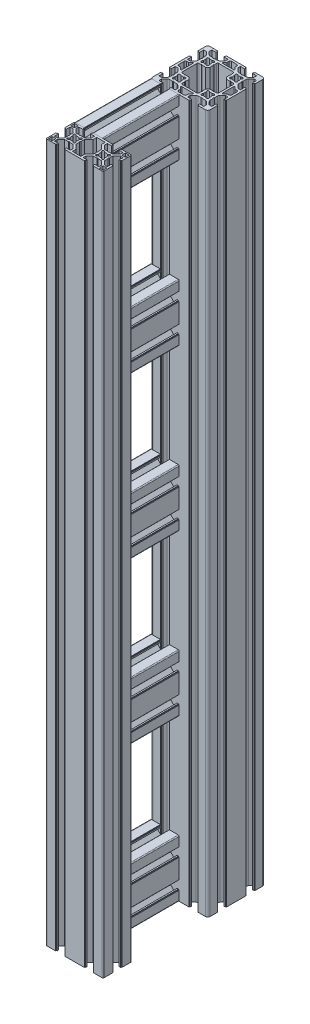
from build123d import *

# Parameters (mm, degrees)
T_SLOT_CNCCAT_6060_1_DEPTH       = 734
T_SLOT_START                     = -367
T_SLOT_CNCCAT_3060_1_OUTLINE_W   = 3.960773678
T_SLOT_CNCCAT_3060_1_OUTLINE_H   = 3.960773678
T_SLOT_CNCCAT_3060_1_DEPTH       = 734
T_SLOT_START_2                   = -85
T_SLOT_CNCCAT_3060_1_2_OUTLINE_W = 3.960773678
T_SLOT_CNCCAT_3060_1_2_OUTLINE_H = 3.960773678
T_SLOT_CNCCAT_3060_1_2_DEPTH     = 140
LPATTERN1_COUNT                  = 5
LPATTERN1_PITCH                  = 168.5


# Read off the part's stored shape, not the designer's step: T-slot CNCCAT-3060(1)
with BuildPart() as part:
    # Sketch23 → T-slot CNCCAT-6060(1) (new body)
    with BuildSketch(Plane(origin=(0, -367, -55), x_dir=(1, 0, 0), z_dir=(0, 1, 0))):
        with BuildLine():
            Line((-27.8, 10.9), (-29.308948277, 10.9))
            Line((-29.308948277, 10.9), (-29.308948277, 10.352456872))
            Line((-29.308948277, 10.352456872), (-30, 10.352456872))
            Line((-30, 10.352456872), (-30, -10.352456872))
            Line((-30, -10.352456872), (-29.308948277, -10.352456872))
            Line((-29.308948277, -10.352456872), (-29.308948277, -10.9))
            Line((-29.308948277, -10.9), (-27.8, -10.9))
            Line((-27.8, -10.9), (-27.8, -6.454151397))
            Line((-27.8, -6.454151397), (-25.075389995, -6.454151397))
            Line((-25.075389995, -6.454151397), (-22.070492345, -9.459049047))
            ThreePointArc((-22.070492345, -9.459049047), (-21.508667773, -10.299878939), (-21.311381219, -11.291705423))
            Line((-21.311381219, -11.291705423), (-21.311381219, -14.439031423))
            ThreePointArc((-21.311381219, -14.439031423), (-20.750412642, -15), (-21.311381219, -15.560968577))
            Line((-21.311381219, -15.560968577), (-21.311381219, -18.708294577))
            ThreePointArc((-21.311381219, -18.708294577), (-21.508667773, -19.700121061), (-22.070492345, -20.540950953))
            Line((-22.070492345, -20.540950953), (-25.075389995, -23.545848603))
            Line((-25.075389995, -23.545848603), (-27.8, -23.545848603))
            Line((-27.8, -23.545848603), (-27.8, -19.1))
            Line((-27.8, -19.1), (-29.308948277, -19.1))
            Line((-29.308948277, -19.1), (-29.308948277, -19.647543128))
            Line((-29.308948277, -19.647543128), (-30, -19.647543128))
            Line((-30, -19.647543128), (-30, -27.5))
            ThreePointArc((-30, -27.5), (-29.267766953, -29.267766953), (-27.5, -30))
            Line((-27.5, -30), (-19.647543128, -30))
            Line((-19.647543128, -30), (-19.647543128, -29.308948277))
            Line((-19.647543128, -29.308948277), (-19.1, -29.308948277))
            Line((-19.1, -29.308948277), (-19.1, -27.8))
            Line((-19.1, -27.8), (-23.545848603, -27.8))
            Line((-23.545848603, -27.8), (-23.545848603, -25.075389995))
            Line((-23.545848603, -25.075389995), (-20.540950953, -22.070492345))
            ThreePointArc((-20.540950953, -22.070492345), (-19.700121061, -21.508667773), (-18.708294577, -21.311381219))
            Line((-18.708294577, -21.311381219), (-15.560968577, -21.311381219))
            ThreePointArc((-15.560968577, -21.311381219), (-15, -20.750412642), (-14.439031423, -21.311381219))
            Line((-14.439031423, -21.311381219), (-11.291705423, -21.311381219))
            ThreePointArc((-11.291705423, -21.311381219), (-10.299878939, -21.508667773), (-9.459049047, -22.070492345))
            Line((-9.459049047, -22.070492345), (-6.454151397, -25.075389995))
            Line((-6.454151397, -25.075389995), (-6.454151397, -27.8))
            Line((-6.454151397, -27.8), (-10.9, -27.8))
            Line((-10.9, -27.8), (-10.9, -29.308948277))
            Line((-10.9, -29.308948277), (-10.352456872, -29.308948277))
            Line((-10.352456872, -29.308948277), (-10.352456872, -30))
            Line((-10.352456872, -30), (10.352456872, -30))
            Line((10.352456872, -30), (10.352456872, -29.308948277))
            Line((10.352456872, -29.308948277), (10.9, -29.308948277))
            Line((10.9, -29.308948277), (10.9, -27.8))
            Line((10.9, -27.8), (6.454151397, -27.8))
            Line((6.454151397, -27.8), (6.454151397, -25.075389995))
            Line((6.454151397, -25.075389995), (9.459049047, -22.070492345))
            ThreePointArc((9.459049047, -22.070492345), (10.299878939, -21.508667773), (11.291705423, -21.311381219))
            Line((11.291705423, -21.311381219), (14.439031423, -21.311381219))
            ThreePointArc((14.439031423, -21.311381219), (15, -20.750412642), (15.560968577, -21.311381219))
            Line((15.560968577, -21.311381219), (18.708294577, -21.311381219))
            ThreePointArc((18.708294577, -21.311381219), (19.700121061, -21.508667773), (20.540950953, -22.070492345))
            Line((20.540950953, -22.070492345), (23.545848603, -25.075389995))
            Line((23.545848603, -25.075389995), (23.545848603, -27.8))
            Line((23.545848603, -27.8), (19.1, -27.8))
            Line((19.1, -27.8), (19.1, -29.308948277))
            Line((19.1, -29.308948277), (19.647543128, -29.308948277))
            Line((19.647543128, -29.308948277), (19.647543128, -30))
            Line((19.647543128, -30), (27.5, -30))
            ThreePointArc((27.5, -30), (29.267766953, -29.267766953), (30, -27.5))
            Line((30, -27.5), (30, -19.647543128))
            Line((30, -19.647543128), (29.308948277, -19.647543128))
            Line((29.308948277, -19.647543128), (29.308948277, -19.1))
            Line((29.308948277, -19.1), (27.8, -19.1))
            Line((27.8, -19.1), (27.8, -23.545848603))
            Line((27.8, -23.545848603), (25.075389995, -23.545848603))
            Line((25.075389995, -23.545848603), (22.070492345, -20.540950953))
            ThreePointArc((22.070492345, -20.540950953), (21.508667773, -19.700121061), (21.311381219, -18.708294577))
            Line((21.311381219, -18.708294577), (21.311381219, -15.560968577))
            ThreePointArc((21.311381219, -15.560968577), (20.750412642, -15), (21.311381219, -14.439031423))
            Line((21.311381219, -14.439031423), (21.311381219, -11.291705423))
            ThreePointArc((21.311381219, -11.291705423), (21.508667773, -10.299878939), (22.070492345, -9.459049047))
            Line((22.070492345, -9.459049047), (25.075389995, -6.454151397))
            Line((25.075389995, -6.454151397), (27.8, -6.454151397))
            Line((27.8, -6.454151397), (27.8, -10.9))
            Line((27.8, -10.9), (29.308948277, -10.9))
            Line((29.308948277, -10.9), (29.308948277, -10.352456872))
            Line((29.308948277, -10.352456872), (30, -10.352456872))
            Line((30, -10.352456872), (30, 10.352456872))
            Line((30, 10.352456872), (29.308948277, 10.352456872))
            Line((29.308948277, 10.352456872), (29.308948277, 10.9))
            Line((29.308948277, 10.9), (27.8, 10.9))
            Line((27.8, 10.9), (27.8, 6.454151397))
            Line((27.8, 6.454151397), (25.075389995, 6.454151397))
            Line((25.075389995, 6.454151397), (22.070492345, 9.459049047))
            ThreePointArc((22.070492345, 9.459049047), (21.508667773, 10.299878939), (21.311381219, 11.291705423))
            Line((21.311381219, 11.291705423), (21.311381219, 14.439031423))
            ThreePointArc((21.311381219, 14.439031423), (20.750412642, 15), (21.311381219, 15.560968577))
            Line((21.311381219, 15.560968577), (21.311381219, 18.708294577))
            ThreePointArc((21.311381219, 18.708294577), (21.508667773, 19.700121061), (22.070492345, 20.540950953))
            Line((22.070492345, 20.540950953), (25.075389995, 23.545848603))
            Line((25.075389995, 23.545848603), (27.8, 23.545848603))
            Line((27.8, 23.545848603), (27.8, 19.1))
            Line((27.8, 19.1), (29.308948277, 19.1))
            Line((29.308948277, 19.1), (29.308948277, 19.647543128))
            Line((29.308948277, 19.647543128), (30, 19.647543128))
            Line((30, 19.647543128), (30, 27.5))
            ThreePointArc((30, 27.5), (29.267766953, 29.267766953), (27.5, 30))
            Line((27.5, 30), (19.647543128, 30))
            Line((19.647543128, 30), (19.647543128, 29.308948277))
            Line((19.647543128, 29.308948277), (19.1, 29.308948277))
            Line((19.1, 29.308948277), (19.1, 27.8))
            Line((19.1, 27.8), (23.545848603, 27.8))
            Line((23.545848603, 27.8), (23.545848603, 25.075389995))
            Line((23.545848603, 25.075389995), (20.540950953, 22.070492345))
            ThreePointArc((20.540950953, 22.070492345), (19.700121061, 21.508667773), (18.708294577, 21.311381219))
            Line((18.708294577, 21.311381219), (15.560968577, 21.311381219))
            ThreePointArc((15.560968577, 21.311381219), (15, 20.750412642), (14.439031423, 21.311381219))
            Line((14.439031423, 21.311381219), (11.291705423, 21.311381219))
            ThreePointArc((11.291705423, 21.311381219), (10.299878939, 21.508667773), (9.459049047, 22.070492345))
            Line((9.459049047, 22.070492345), (6.454151397, 25.075389995))
            Line((6.454151397, 25.075389995), (6.454151397, 27.8))
            Line((6.454151397, 27.8), (10.9, 27.8))
            Line((10.9, 27.8), (10.9, 29.308948277))
            Line((10.9, 29.308948277), (10.352456872, 29.308948277))
            Line((10.352456872, 29.308948277), (10.352456872, 30))
            Line((10.352456872, 30), (-10.352456872, 30))
            Line((-10.352456872, 30), (-10.352456872, 29.308948277))
            Line((-10.352456872, 29.308948277), (-10.9, 29.308948277))
            Line((-10.9, 29.308948277), (-10.9, 27.8))
            Line((-10.9, 27.8), (-6.454151397, 27.8))
            Line((-6.454151397, 27.8), (-6.454151397, 25.075389995))
            Line((-6.454151397, 25.075389995), (-9.459049047, 22.070492345))
            ThreePointArc((-9.459049047, 22.070492345), (-10.299878939, 21.508667773), (-11.291705423, 21.311381219))
            Line((-11.291705423, 21.311381219), (-14.439031423, 21.311381219))
            ThreePointArc((-14.439031423, 21.311381219), (-15, 20.750412642), (-15.560968577, 21.311381219))
            Line((-15.560968577, 21.311381219), (-18.708294577, 21.311381219))
            ThreePointArc((-18.708294577, 21.311381219), (-19.700121061, 21.508667773), (-20.540950953, 22.070492345))
            Line((-20.540950953, 22.070492345), (-23.545848603, 25.075389995))
            Line((-23.545848603, 25.075389995), (-23.545848603, 27.8))
            Line((-23.545848603, 27.8), (-19.1, 27.8))
            Line((-19.1, 27.8), (-19.1, 29.308948277))
            Line((-19.1, 29.308948277), (-19.647543128, 29.308948277))
            Line((-19.647543128, 29.308948277), (-19.647543128, 30))
            Line((-19.647543128, 30), (-27.5, 30))
            ThreePointArc((-27.5, 30), (-29.267766953, 29.267766953), (-30, 27.5))
            Line((-30, 27.5), (-30, 19.647543128))
            Line((-30, 19.647543128), (-29.308948277, 19.647543128))
            Line((-29.308948277, 19.647543128), (-29.308948277, 19.1))
            Line((-29.308948277, 19.1), (-27.8, 19.1))
            Line((-27.8, 19.1), (-27.8, 23.545848603))
            Line((-27.8, 23.545848603), (-25.075389995, 23.545848603))
            Line((-25.075389995, 23.545848603), (-22.070492345, 20.540950953))
            ThreePointArc((-22.070492345, 20.540950953), (-21.508667773, 19.700121061), (-21.311381219, 18.708294577))
            Line((-21.311381219, 18.708294577), (-21.311381219, 15.560968577))
            ThreePointArc((-21.311381219, 15.560968577), (-20.750412642, 15), (-21.311381219, 14.439031423))
            Line((-21.311381219, 14.439031423), (-21.311381219, 11.291705423))
            ThreePointArc((-21.311381219, 11.291705423), (-21.508667773, 10.299878939), (-22.070492345, 9.459049047))
            Line((-22.070492345, 9.459049047), (-25.075389995, 6.454151397))
            Line((-25.075389995, 6.454151397), (-27.8, 6.454151397))
            Line((-27.8, 6.454151397), (-27.8, 10.9))
        make_face()
        with BuildLine():
            Line((18.193140614, 16.433127007), (18.602611084, 16.842597476))
            ThreePointArc((18.602611084, 16.842597476), (18.602611084, 18.602611084), (16.842597476, 18.602611084))
            Line((16.842597476, 18.602611084), (16.433127007, 18.193140614))
            ThreePointArc((16.433127007, 18.193140614), (15, 18.5), (13.566872993, 18.193140614))
            Line((13.566872993, 18.193140614), (13.157402524, 18.602611084))
            ThreePointArc((13.157402524, 18.602611084), (11.397388916, 18.602611084), (11.397388916, 16.842597476))
            Line((11.397388916, 16.842597476), (11.806859386, 16.433127007))
            ThreePointArc((11.806859386, 16.433127007), (11.5, 15), (11.806859386, 13.566872993))
            Line((11.806859386, 13.566872993), (11.397388916, 13.157402524))
            ThreePointArc((11.397388916, 13.157402524), (11.397388916, 11.397388916), (13.157402524, 11.397388916))
            Line((13.157402524, 11.397388916), (13.566872993, 11.806859386))
            ThreePointArc((13.566872993, 11.806859386), (15, 11.5), (16.433127007, 11.806859386))
            Line((16.433127007, 11.806859386), (16.842597476, 11.397388916))
            ThreePointArc((16.842597476, 11.397388916), (18.602611084, 11.397388916), (18.602611084, 13.157402524))
            Line((18.602611084, 13.157402524), (18.193140614, 13.566872993))
            ThreePointArc((18.193140614, 13.566872993), (18.5, 15), (18.193140614, 16.433127007))
        make_face(mode=Mode.SUBTRACT)
        with BuildLine():
            Line((6.282040861, 22.24002752), (4.26564751, 24.396147163))
            Line((4.26564751, 24.396147163), (4.26564751, 26.445405504))
            ThreePointArc((4.26564751, 26.445405504), (3.694557458, 27.417202224), (2.634369467, 27.8))
            Line((2.634369467, 27.8), (-2.634369467, 27.8))
            ThreePointArc((-2.634369467, 27.8), (-3.694557458, 27.417202224), (-4.26564751, 26.445405504))
            Line((-4.26564751, 26.445405504), (-4.26564751, 24.396147163))
            Line((-4.26564751, 24.396147163), (-6.282040861, 22.24002752))
            ThreePointArc((-6.282040861, 22.24002752), (-6.388091607, 21.626794699), (-5.867763364, 21.285386186))
            Line((-5.867763364, 21.285386186), (5.867763364, 21.285386186))
            ThreePointArc((5.867763364, 21.285386186), (6.388091607, 21.626794699), (6.282040861, 22.24002752))
        make_face(mode=Mode.SUBTRACT)
        with BuildLine():
            Line((-18.193140614, 13.566872993), (-18.602611084, 13.157402524))
            ThreePointArc((-18.602611084, 13.157402524), (-18.602611084, 11.397388916), (-16.842597476, 11.397388916))
            Line((-16.842597476, 11.397388916), (-16.433127007, 11.806859386))
            ThreePointArc((-16.433127007, 11.806859386), (-15, 11.5), (-13.566872993, 11.806859386))
            Line((-13.566872993, 11.806859386), (-13.157402524, 11.397388916))
            ThreePointArc((-13.157402524, 11.397388916), (-11.397388916, 11.397388916), (-11.397388916, 13.157402524))
            Line((-11.397388916, 13.157402524), (-11.806859386, 13.566872993))
            ThreePointArc((-11.806859386, 13.566872993), (-11.5, 15), (-11.806859386, 16.433127007))
            Line((-11.806859386, 16.433127007), (-11.397388916, 16.842597476))
            ThreePointArc((-11.397388916, 16.842597476), (-11.397388916, 18.602611084), (-13.157402524, 18.602611084))
            Line((-13.157402524, 18.602611084), (-13.566872993, 18.193140614))
            ThreePointArc((-13.566872993, 18.193140614), (-15, 18.5), (-16.433127007, 18.193140614))
            Line((-16.433127007, 18.193140614), (-16.842597476, 18.602611084))
            ThreePointArc((-16.842597476, 18.602611084), (-18.602611084, 18.602611084), (-18.602611084, 16.842597476))
            Line((-18.602611084, 16.842597476), (-18.193140614, 16.433127007))
            ThreePointArc((-18.193140614, 16.433127007), (-18.5, 15), (-18.193140614, 13.566872993))
        make_face(mode=Mode.SUBTRACT)
        with BuildLine():
            Line((18.193140614, -13.566872993), (18.602611084, -13.157402524))
            ThreePointArc((18.602611084, -13.157402524), (18.602611084, -11.397388916), (16.842597476, -11.397388916))
            Line((16.842597476, -11.397388916), (16.433127007, -11.806859386))
            ThreePointArc((16.433127007, -11.806859386), (15, -11.5), (13.566872993, -11.806859386))
            Line((13.566872993, -11.806859386), (13.157402524, -11.397388916))
            ThreePointArc((13.157402524, -11.397388916), (11.397388916, -11.397388916), (11.397388916, -13.157402524))
            Line((11.397388916, -13.157402524), (11.806859386, -13.566872993))
            ThreePointArc((11.806859386, -13.566872993), (11.5, -15), (11.806859386, -16.433127007))
            Line((11.806859386, -16.433127007), (11.397388916, -16.842597476))
            ThreePointArc((11.397388916, -16.842597476), (11.397388916, -18.602611084), (13.157402524, -18.602611084))
            Line((13.157402524, -18.602611084), (13.566872993, -18.193140614))
            ThreePointArc((13.566872993, -18.193140614), (15, -18.5), (16.433127007, -18.193140614))
            Line((16.433127007, -18.193140614), (16.842597476, -18.602611084))
            ThreePointArc((16.842597476, -18.602611084), (18.602611084, -18.602611084), (18.602611084, -16.842597476))
            Line((18.602611084, -16.842597476), (18.193140614, -16.433127007))
            ThreePointArc((18.193140614, -16.433127007), (18.5, -15), (18.193140614, -13.566872993))
        make_face(mode=Mode.SUBTRACT)
        with BuildLine():
            Line((-6.282040861, -22.24002752), (-4.26564751, -24.396147163))
            Line((-4.26564751, -24.396147163), (-4.26564751, -26.445405504))
            ThreePointArc((-4.26564751, -26.445405504), (-3.694557458, -27.417202224), (-2.634369467, -27.8))
            Line((-2.634369467, -27.8), (2.634369467, -27.8))
            ThreePointArc((2.634369467, -27.8), (3.694557458, -27.417202224), (4.26564751, -26.445405504))
            Line((4.26564751, -26.445405504), (4.26564751, -24.396147163))
            Line((4.26564751, -24.396147163), (6.282040861, -22.24002752))
            ThreePointArc((6.282040861, -22.24002752), (6.388091607, -21.626794699), (5.867763364, -21.285386186))
            Line((5.867763364, -21.285386186), (-5.867763364, -21.285386186))
            ThreePointArc((-5.867763364, -21.285386186), (-6.388091607, -21.626794699), (-6.282040861, -22.24002752))
        make_face(mode=Mode.SUBTRACT)
        with BuildLine():
            Line((-18.193140614, -16.433127007), (-18.602611084, -16.842597476))
            ThreePointArc((-18.602611084, -16.842597476), (-18.602611084, -18.602611084), (-16.842597476, -18.602611084))
            Line((-16.842597476, -18.602611084), (-16.433127007, -18.193140614))
            ThreePointArc((-16.433127007, -18.193140614), (-15, -18.5), (-13.566872993, -18.193140614))
            Line((-13.566872993, -18.193140614), (-13.157402524, -18.602611084))
            ThreePointArc((-13.157402524, -18.602611084), (-11.397388916, -18.602611084), (-11.397388916, -16.842597476))
            Line((-11.397388916, -16.842597476), (-11.806859386, -16.433127007))
            ThreePointArc((-11.806859386, -16.433127007), (-11.5, -15), (-11.806859386, -13.566872993))
            Line((-11.806859386, -13.566872993), (-11.397388916, -13.157402524))
            ThreePointArc((-11.397388916, -13.157402524), (-11.397388916, -11.397388916), (-13.157402524, -11.397388916))
            Line((-13.157402524, -11.397388916), (-13.566872993, -11.806859386))
            ThreePointArc((-13.566872993, -11.806859386), (-15, -11.5), (-16.433127007, -11.806859386))
            Line((-16.433127007, -11.806859386), (-16.842597476, -11.397388916))
            ThreePointArc((-16.842597476, -11.397388916), (-18.602611084, -11.397388916), (-18.602611084, -13.157402524))
            Line((-18.602611084, -13.157402524), (-18.193140614, -13.566872993))
            ThreePointArc((-18.193140614, -13.566872993), (-18.5, -15), (-18.193140614, -16.433127007))
        make_face(mode=Mode.SUBTRACT)
        with BuildLine():
            Line((24.396147163, 4.26564751), (22.24002752, 6.282040861))
            ThreePointArc((22.24002752, 6.282040861), (21.626794699, 6.388091607), (21.285386186, 5.867763364))
            Line((21.285386186, 5.867763364), (21.285386186, -5.867763364))
            ThreePointArc((21.285386186, -5.867763364), (21.626794699, -6.388091607), (22.24002752, -6.282040861))
            Line((22.24002752, -6.282040861), (24.396147163, -4.26564751))
            Line((24.396147163, -4.26564751), (26.445405504, -4.26564751))
            ThreePointArc((26.445405504, -4.26564751), (27.417202224, -3.694557458), (27.8, -2.634369467))
            Line((27.8, -2.634369467), (27.8, 2.634369467))
            ThreePointArc((27.8, 2.634369467), (27.417202224, 3.694557458), (26.445405504, 4.26564751))
            Line((26.445405504, 4.26564751), (24.396147163, 4.26564751))
        make_face(mode=Mode.SUBTRACT)
        with BuildLine():
            Line((-24.396147163, 4.26564751), (-26.445405504, 4.26564751))
            ThreePointArc((-26.445405504, 4.26564751), (-27.417202224, 3.694557458), (-27.8, 2.634369467))
            Line((-27.8, 2.634369467), (-27.8, -2.634369467))
            ThreePointArc((-27.8, -2.634369467), (-27.417202224, -3.694557458), (-26.445405504, -4.26564751))
            Line((-26.445405504, -4.26564751), (-24.396147163, -4.26564751))
            Line((-24.396147163, -4.26564751), (-22.24002752, -6.282040861))
            ThreePointArc((-22.24002752, -6.282040861), (-21.626794699, -6.388091607), (-21.285386186, -5.867763364))
            Line((-21.285386186, -5.867763364), (-21.285386186, 5.867763364))
            ThreePointArc((-21.285386186, 5.867763364), (-21.626794699, 6.388091607), (-22.24002752, 6.282040861))
            Line((-22.24002752, 6.282040861), (-24.396147163, 4.26564751))
        make_face(mode=Mode.SUBTRACT)
        with BuildLine():
            Line((-18.034191115, -8.800723479), (-15.557567424, -8.800723479))
            ThreePointArc((-15.557567424, -8.800723479), (-15.054765689, -9.303525214), (-14.551963954, -8.800723479))
            Line((-14.551963954, -8.800723479), (-10.998266395, -8.800723479))
            Line((-10.998266395, -8.800723479), (-8.800723479, -10.998266395))
            Line((-8.800723479, -10.998266395), (-8.800723479, -14.551963954))
            ThreePointArc((-8.800723479, -14.551963954), (-9.303525214, -15.054765689), (-8.800723479, -15.557567424))
            Line((-8.800723479, -15.557567424), (-8.800723479, -18.034191115))
            ThreePointArc((-8.800723479, -18.034191115), (-8.470816457, -18.830657122), (-7.67435045, -19.160564144))
            Line((-7.67435045, -19.160564144), (7.67435045, -19.160564144))
            ThreePointArc((7.67435045, -19.160564144), (8.470816457, -18.830657122), (8.800723479, -18.034191115))
            Line((8.800723479, -18.034191115), (8.800723479, -15.557567424))
            ThreePointArc((8.800723479, -15.557567424), (9.303525214, -15.054765689), (8.800723479, -14.551963954))
            Line((8.800723479, -14.551963954), (8.800723479, -10.998266395))
            Line((8.800723479, -10.998266395), (10.998266395, -8.800723479))
            Line((10.998266395, -8.800723479), (14.551963954, -8.800723479))
            ThreePointArc((14.551963954, -8.800723479), (15.054765689, -9.303525214), (15.557567424, -8.800723479))
            Line((15.557567424, -8.800723479), (18.034191115, -8.800723479))
            ThreePointArc((18.034191115, -8.800723479), (18.830657122, -8.470816457), (19.160564144, -7.67435045))
            Line((19.160564144, -7.67435045), (19.160564144, 7.67435045))
            ThreePointArc((19.160564144, 7.67435045), (18.830657122, 8.470816457), (18.034191115, 8.800723479))
            Line((18.034191115, 8.800723479), (15.557567424, 8.800723479))
            ThreePointArc((15.557567424, 8.800723479), (15.054765689, 9.303525214), (14.551963954, 8.800723479))
            Line((14.551963954, 8.800723479), (10.998266395, 8.800723479))
            Line((10.998266395, 8.800723479), (8.800723479, 10.998266395))
            Line((8.800723479, 10.998266395), (8.800723479, 14.551963954))
            ThreePointArc((8.800723479, 14.551963954), (9.303525214, 15.054765689), (8.800723479, 15.557567424))
            Line((8.800723479, 15.557567424), (8.800723479, 18.034191115))
            ThreePointArc((8.800723479, 18.034191115), (8.470816457, 18.830657122), (7.67435045, 19.160564144))
            Line((7.67435045, 19.160564144), (-7.67435045, 19.160564144))
            ThreePointArc((-7.67435045, 19.160564144), (-8.470816457, 18.830657122), (-8.800723479, 18.034191115))
            Line((-8.800723479, 18.034191115), (-8.800723479, 15.557567424))
            ThreePointArc((-8.800723479, 15.557567424), (-9.303525214, 15.054765689), (-8.800723479, 14.551963954))
            Line((-8.800723479, 14.551963954), (-8.800723479, 10.998266395))
            Line((-8.800723479, 10.998266395), (-10.998266395, 8.800723479))
            Line((-10.998266395, 8.800723479), (-14.551963954, 8.800723479))
            ThreePointArc((-14.551963954, 8.800723479), (-15.054765689, 9.303525214), (-15.557567424, 8.800723479))
            Line((-15.557567424, 8.800723479), (-18.034191115, 8.800723479))
            ThreePointArc((-18.034191115, 8.800723479), (-18.830657122, 8.470816457), (-19.160564144, 7.67435045))
            Line((-19.160564144, 7.67435045), (-19.160564144, -7.67435045))
            ThreePointArc((-19.160564144, -7.67435045), (-18.830657122, -8.470816457), (-18.034191115, -8.800723479))
        make_face(mode=Mode.SUBTRACT)
    extrude(amount=T_SLOT_CNCCAT_6060_1_DEPTH)


with BuildPart() as body_2:
    # T-slot CNCCAT-3060(1) outline → T-slot CNCCAT-3060(1) (new body)
    with BuildSketch(Plane(origin=(0, 0, 0), x_dir=(1, 0, 0), z_dir=(0, 1, 0)).offset(T_SLOT_START)):
        with BuildLine():
            Line((-20.956716316, -69.380405557), (-20.337121873, -70))
            Line((-20.337121873, -70), (-20.956716316, -70.619594443))
            Line((-20.956716316, -70.619594443), (-20.956716316, -74.401081398))
            Line((-20.956716316, -74.401081398), (-24.863654578, -78.30801966))
            Line((-24.863654578, -78.30801966), (-27.8, -78.30801966))
            Line((-27.8, -78.30801966), (-27.8, -74.1))
            Line((-27.8, -74.1), (-29.233870922, -74.1))
            Line((-29.233870922, -74.1), (-29.233870922, -74.756280561))
            Line((-29.233870922, -74.756280561), (-30, -74.756280561))
            Line((-30, -74.756280561), (-30, -84))
            ThreePointArc((-30, -84), (-29.707106781, -84.707106781), (-29, -85))
            Line((-29, -85), (-19.756280561, -85))
            Line((-19.756280561, -85), (-19.756280561, -84.233870922))
            Line((-19.756280561, -84.233870922), (-19.1, -84.233870922))
            Line((-19.1, -84.233870922), (-19.1, -82.8))
            Line((-19.1, -82.8), (-23.30801966, -82.8))
            Line((-23.30801966, -82.8), (-23.30801966, -79.863654578))
            Line((-23.30801966, -79.863654578), (-19.401081398, -75.956716316))
            Line((-19.401081398, -75.956716316), (-15.619594443, -75.956716316))
            Line((-15.619594443, -75.956716316), (-15, -75.337121873))
            Line((-15, -75.337121873), (-14.380405557, -75.956716316))
            Line((-14.380405557, -75.956716316), (-10.598918602, -75.956716316))
            Line((-10.598918602, -75.956716316), (-6.69198034, -79.863654578))
            Line((-6.69198034, -79.863654578), (-6.69198034, -82.8))
            Line((-6.69198034, -82.8), (-10.9, -82.8))
            Line((-10.9, -82.8), (-10.9, -84.233870922))
            Line((-10.9, -84.233870922), (-10.243719439, -84.233870922))
            Line((-10.243719439, -84.233870922), (-10.243719439, -85))
            Line((-10.243719439, -85), (10.243719439, -85))
            Line((10.243719439, -85), (10.243719439, -84.233870922))
            Line((10.243719439, -84.233870922), (10.9, -84.233870922))
            Line((10.9, -84.233870922), (10.9, -82.8))
            Line((10.9, -82.8), (6.69198034, -82.8))
            Line((6.69198034, -82.8), (6.69198034, -79.863654578))
            Line((6.69198034, -79.863654578), (10.598918602, -75.956716316))
            Line((10.598918602, -75.956716316), (14.380405557, -75.956716316))
            Line((14.380405557, -75.956716316), (15, -75.337121873))
            Line((15, -75.337121873), (15.619594443, -75.956716316))
            Line((15.619594443, -75.956716316), (19.401081398, -75.956716316))
            Line((19.401081398, -75.956716316), (23.30801966, -79.863654578))
            Line((23.30801966, -79.863654578), (23.30801966, -82.8))
            Line((23.30801966, -82.8), (19.1, -82.8))
            Line((19.1, -82.8), (19.1, -84.233870922))
            Line((19.1, -84.233870922), (19.756280561, -84.233870922))
            Line((19.756280561, -84.233870922), (19.756280561, -85))
            Line((19.756280561, -85), (29, -85))
            ThreePointArc((29, -85), (29.707106781, -84.707106781), (30, -84))
            Line((30, -84), (30, -74.756280561))
            Line((30, -74.756280561), (29.233870922, -74.756280561))
            Line((29.233870922, -74.756280561), (29.233870922, -74.1))
            Line((29.233870922, -74.1), (27.8, -74.1))
            Line((27.8, -74.1), (27.8, -78.30801966))
            Line((27.8, -78.30801966), (24.863654578, -78.30801966))
            Line((24.863654578, -78.30801966), (20.956716316, -74.401081398))
            Line((20.956716316, -74.401081398), (20.956716316, -70.619594443))
            Line((20.956716316, -70.619594443), (20.337121873, -70))
            Line((20.337121873, -70), (20.956716316, -69.380405557))
            Line((20.956716316, -69.380405557), (20.956716316, -65.598918602))
            Line((20.956716316, -65.598918602), (24.863654578, -61.69198034))
            Line((24.863654578, -61.69198034), (27.8, -61.69198034))
            Line((27.8, -61.69198034), (27.8, -65.9))
            Line((27.8, -65.9), (29.233870922, -65.9))
            Line((29.233870922, -65.9), (29.233870922, -65.243719439))
            Line((29.233870922, -65.243719439), (30, -65.243719439))
            Line((30, -65.243719439), (30, -56))
            ThreePointArc((30, -56), (29.707106781, -55.292893219), (29, -55))
            Line((29, -55), (19.756280561, -55))
            Line((19.756280561, -55), (19.756280561, -55.766129078))
            Line((19.756280561, -55.766129078), (19.1, -55.766129078))
            Line((19.1, -55.766129078), (19.1, -57.2))
            Line((19.1, -57.2), (23.30801966, -57.2))
            Line((23.30801966, -57.2), (23.30801966, -60.136345422))
            Line((23.30801966, -60.136345422), (19.401081398, -64.043283684))
            Line((19.401081398, -64.043283684), (15.619594443, -64.043283684))
            Line((15.619594443, -64.043283684), (15, -64.662878127))
            Line((15, -64.662878127), (14.380405557, -64.043283684))
            Line((14.380405557, -64.043283684), (10.598918602, -64.043283684))
            Line((10.598918602, -64.043283684), (6.69198034, -60.136345422))
            Line((6.69198034, -60.136345422), (6.69198034, -57.2))
            Line((6.69198034, -57.2), (10.9, -57.2))
            Line((10.9, -57.2), (10.9, -55.766129078))
            Line((10.9, -55.766129078), (10.243719439, -55.766129078))
            Line((10.243719439, -55.766129078), (10.243719439, -55))
            Line((10.243719439, -55), (-10.243719439, -55))
            Line((-10.243719439, -55), (-10.243719439, -55.766129078))
            Line((-10.243719439, -55.766129078), (-10.9, -55.766129078))
            Line((-10.9, -55.766129078), (-10.9, -57.2))
            Line((-10.9, -57.2), (-6.69198034, -57.2))
            Line((-6.69198034, -57.2), (-6.69198034, -60.136345422))
            Line((-6.69198034, -60.136345422), (-10.598918602, -64.043283684))
            Line((-10.598918602, -64.043283684), (-14.380405557, -64.043283684))
            Line((-14.380405557, -64.043283684), (-15, -64.662878127))
            Line((-15, -64.662878127), (-15.619594443, -64.043283684))
            Line((-15.619594443, -64.043283684), (-19.401081398, -64.043283684))
            Line((-19.401081398, -64.043283684), (-23.30801966, -60.136345422))
            Line((-23.30801966, -60.136345422), (-23.30801966, -57.2))
            Line((-23.30801966, -57.2), (-19.1, -57.2))
            Line((-19.1, -57.2), (-19.1, -55.766129078))
            Line((-19.1, -55.766129078), (-19.756280561, -55.766129078))
            Line((-19.756280561, -55.766129078), (-19.756280561, -55))
            Line((-19.756280561, -55), (-29, -55))
            ThreePointArc((-29, -55), (-29.707106781, -55.292893219), (-30, -56))
            Line((-30, -56), (-30, -65.243719439))
            Line((-30, -65.243719439), (-29.233870922, -65.243719439))
            Line((-29.233870922, -65.243719439), (-29.233870922, -65.9))
            Line((-29.233870922, -65.9), (-27.8, -65.9))
            Line((-27.8, -65.9), (-27.8, -61.69198034))
            Line((-27.8, -61.69198034), (-24.863654578, -61.69198034))
            Line((-24.863654578, -61.69198034), (-20.956716316, -65.598918602))
            Line((-20.956716316, -65.598918602), (-20.956716316, -69.380405557))
        make_face()
        with Locations((-26.75, -81.75)):
            Rectangle(T_SLOT_CNCCAT_3060_1_OUTLINE_W, T_SLOT_CNCCAT_3060_1_OUTLINE_H, mode=Mode.SUBTRACT)
        with Locations((26.75, -81.75)):
            Rectangle(T_SLOT_CNCCAT_3060_1_OUTLINE_W, T_SLOT_CNCCAT_3060_1_OUTLINE_H, mode=Mode.SUBTRACT)
        with BuildLine():
            Line((-19.109450474, -72.695236912), (-18.078815026, -71.664601464))
            ThreePointArc((-18.078815026, -71.664601464), (-18.5, -70), (-18.078815026, -68.335398536))
            Line((-18.078815026, -68.335398536), (-19.109450474, -67.304763088))
            ThreePointArc((-19.109450474, -67.304763088), (-19.109450474, -65.890549526), (-17.695236912, -65.890549526))
            Line((-17.695236912, -65.890549526), (-16.664601464, -66.921184974))
            ThreePointArc((-16.664601464, -66.921184974), (-15, -66.5), (-13.335398536, -66.921184974))
            Line((-13.335398536, -66.921184974), (-12.304763088, -65.890549526))
            ThreePointArc((-12.304763088, -65.890549526), (-10.890549526, -65.890549526), (-10.890549526, -67.304763088))
            Line((-10.890549526, -67.304763088), (-11.921184974, -68.335398536))
            ThreePointArc((-11.921184974, -68.335398536), (-11.5, -70), (-11.921184974, -71.664601464))
            Line((-11.921184974, -71.664601464), (-10.890549526, -72.695236912))
            ThreePointArc((-10.890549526, -72.695236912), (-10.890549526, -74.109450474), (-12.304763088, -74.109450474))
            Line((-12.304763088, -74.109450474), (-13.335398536, -73.078815026))
            ThreePointArc((-13.335398536, -73.078815026), (-15, -73.5), (-16.664601464, -73.078815026))
            Line((-16.664601464, -73.078815026), (-17.695236912, -74.109450474))
            ThreePointArc((-17.695236912, -74.109450474), (-19.109450474, -74.109450474), (-19.109450474, -72.695236912))
        make_face(mode=Mode.SUBTRACT)
        with Locations((-26.75, -58.25)):
            Rectangle(T_SLOT_CNCCAT_3060_1_OUTLINE_W, T_SLOT_CNCCAT_3060_1_OUTLINE_H, mode=Mode.SUBTRACT)
        Polygon((4.49198034, -78.952384741), (4.49198034, -82.8), (-4.49198034, -82.8), (-4.49198034, -78.952384741), (-9.043283684, -74.401081398), (-9.043283684, -70.619594443), (-9.662878127, -70), (-9.043283684, -69.380405557), (-9.043283684, -65.598918602), (-4.49198034, -61.047615259), (-4.49198034, -57.2), (4.49198034, -57.2), (4.49198034, -61.047615259), (9.043283684, -65.598918602), (9.043283684, -69.380405557), (9.662878127, -70), (9.043283684, -70.619594443), (9.043283684, -74.401081398), align=None, mode=Mode.SUBTRACT)
        with BuildLine():
            Line((19.109450474, -67.304763088), (18.078815026, -68.335398536))
            ThreePointArc((18.078815026, -68.335398536), (18.5, -70), (18.078815026, -71.664601464))
            Line((18.078815026, -71.664601464), (19.109450474, -72.695236912))
            ThreePointArc((19.109450474, -72.695236912), (19.109450474, -74.109450474), (17.695236912, -74.109450474))
            Line((17.695236912, -74.109450474), (16.664601464, -73.078815026))
            ThreePointArc((16.664601464, -73.078815026), (15, -73.5), (13.335398536, -73.078815026))
            Line((13.335398536, -73.078815026), (12.304763088, -74.109450474))
            ThreePointArc((12.304763088, -74.109450474), (10.890549526, -74.109450474), (10.890549526, -72.695236912))
            Line((10.890549526, -72.695236912), (11.921184974, -71.664601464))
            ThreePointArc((11.921184974, -71.664601464), (11.5, -70), (11.921184974, -68.335398536))
            Line((11.921184974, -68.335398536), (10.890549526, -67.304763088))
            ThreePointArc((10.890549526, -67.304763088), (10.890549526, -65.890549526), (12.304763088, -65.890549526))
            Line((12.304763088, -65.890549526), (13.335398536, -66.921184974))
            ThreePointArc((13.335398536, -66.921184974), (15, -66.5), (16.664601464, -66.921184974))
            Line((16.664601464, -66.921184974), (17.695236912, -65.890549526))
            ThreePointArc((17.695236912, -65.890549526), (19.109450474, -65.890549526), (19.109450474, -67.304763088))
        make_face(mode=Mode.SUBTRACT)
        with Locations((26.75, -58.25)):
            Rectangle(T_SLOT_CNCCAT_3060_1_OUTLINE_W, T_SLOT_CNCCAT_3060_1_OUTLINE_H, mode=Mode.SUBTRACT)
    extrude(amount=T_SLOT_CNCCAT_3060_1_DEPTH)


with BuildPart() as body_3:
    # T-slot CNCCAT-3060_1 2 outline → T-slot CNCCAT-3060_1 2 (new body)
    with BuildSketch(Plane.XY.offset(T_SLOT_START_2)):
        with BuildLine():
            Line((-20.956716316, -317.598918602), (-20.956716316, -321.380405557))
            Line((-20.956716316, -321.380405557), (-20.337121873, -322))
            Line((-20.337121873, -322), (-20.956716316, -322.619594443))
            Line((-20.956716316, -322.619594443), (-20.956716316, -326.401081398))
            Line((-20.956716316, -326.401081398), (-24.863654578, -330.30801966))
            Line((-24.863654578, -330.30801966), (-27.8, -330.30801966))
            Line((-27.8, -330.30801966), (-27.8, -326.1))
            Line((-27.8, -326.1), (-29.233870922, -326.1))
            Line((-29.233870922, -326.1), (-29.233870922, -326.756280561))
            Line((-29.233870922, -326.756280561), (-30, -326.756280561))
            Line((-30, -326.756280561), (-30, -347.243719439))
            Line((-30, -347.243719439), (-29.233870922, -347.243719439))
            Line((-29.233870922, -347.243719439), (-29.233870922, -347.9))
            Line((-29.233870922, -347.9), (-27.8, -347.9))
            Line((-27.8, -347.9), (-27.8, -343.69198034))
            Line((-27.8, -343.69198034), (-24.863654578, -343.69198034))
            Line((-24.863654578, -343.69198034), (-20.956716316, -347.598918602))
            Line((-20.956716316, -347.598918602), (-20.956716316, -351.380405557))
            Line((-20.956716316, -351.380405557), (-20.337121873, -352))
            Line((-20.337121873, -352), (-20.956716316, -352.619594443))
            Line((-20.956716316, -352.619594443), (-20.956716316, -356.401081398))
            Line((-20.956716316, -356.401081398), (-24.863654578, -360.30801966))
            Line((-24.863654578, -360.30801966), (-27.8, -360.30801966))
            Line((-27.8, -360.30801966), (-27.8, -356.1))
            Line((-27.8, -356.1), (-29.233870922, -356.1))
            Line((-29.233870922, -356.1), (-29.233870922, -356.756280561))
            Line((-29.233870922, -356.756280561), (-30, -356.756280561))
            Line((-30, -356.756280561), (-30, -366))
            ThreePointArc((-30, -366), (-29.707106781, -366.707106781), (-29, -367))
            Line((-29, -367), (-19.756280561, -367))
            Line((-19.756280561, -367), (-19.756280561, -366.233870922))
            Line((-19.756280561, -366.233870922), (-19.1, -366.233870922))
            Line((-19.1, -366.233870922), (-19.1, -364.8))
            Line((-19.1, -364.8), (-23.30801966, -364.8))
            Line((-23.30801966, -364.8), (-23.30801966, -361.863654578))
            Line((-23.30801966, -361.863654578), (-19.401081398, -357.956716316))
            Line((-19.401081398, -357.956716316), (-15.619594443, -357.956716316))
            Line((-15.619594443, -357.956716316), (-15, -357.337121873))
            Line((-15, -357.337121873), (-14.380405557, -357.956716316))
            Line((-14.380405557, -357.956716316), (-10.598918602, -357.956716316))
            Line((-10.598918602, -357.956716316), (-6.69198034, -361.863654578))
            Line((-6.69198034, -361.863654578), (-6.69198034, -364.8))
            Line((-6.69198034, -364.8), (-10.9, -364.8))
            Line((-10.9, -364.8), (-10.9, -366.233870922))
            Line((-10.9, -366.233870922), (-10.243719439, -366.233870922))
            Line((-10.243719439, -366.233870922), (-10.243719439, -367))
            Line((-10.243719439, -367), (-1, -367))
            ThreePointArc((-1, -367), (-0.292893219, -366.707106781), (0, -366))
            Line((0, -366), (0, -356.756280561))
            Line((0, -356.756280561), (-0.766129078, -356.756280561))
            Line((-0.766129078, -356.756280561), (-0.766129078, -356.1))
            Line((-0.766129078, -356.1), (-2.2, -356.1))
            Line((-2.2, -356.1), (-2.2, -360.30801966))
            Line((-2.2, -360.30801966), (-5.136345422, -360.30801966))
            Line((-5.136345422, -360.30801966), (-9.043283684, -356.401081398))
            Line((-9.043283684, -356.401081398), (-9.043283684, -352.619594443))
            Line((-9.043283684, -352.619594443), (-9.662878127, -352))
            Line((-9.662878127, -352), (-9.043283684, -351.380405557))
            Line((-9.043283684, -351.380405557), (-9.043283684, -347.598918602))
            Line((-9.043283684, -347.598918602), (-5.136345422, -343.69198034))
            Line((-5.136345422, -343.69198034), (-2.2, -343.69198034))
            Line((-2.2, -343.69198034), (-2.2, -347.9))
            Line((-2.2, -347.9), (-0.766129078, -347.9))
            Line((-0.766129078, -347.9), (-0.766129078, -347.243719439))
            Line((-0.766129078, -347.243719439), (0, -347.243719439))
            Line((0, -347.243719439), (0, -326.756280561))
            Line((0, -326.756280561), (-0.766129078, -326.756280561))
            Line((-0.766129078, -326.756280561), (-0.766129078, -326.1))
            Line((-0.766129078, -326.1), (-2.2, -326.1))
            Line((-2.2, -326.1), (-2.2, -330.30801966))
            Line((-2.2, -330.30801966), (-5.136345422, -330.30801966))
            Line((-5.136345422, -330.30801966), (-9.043283684, -326.401081398))
            Line((-9.043283684, -326.401081398), (-9.043283684, -322.619594443))
            Line((-9.043283684, -322.619594443), (-9.662878127, -322))
            Line((-9.662878127, -322), (-9.043283684, -321.380405557))
            Line((-9.043283684, -321.380405557), (-9.043283684, -317.598918602))
            Line((-9.043283684, -317.598918602), (-5.136345422, -313.69198034))
            Line((-5.136345422, -313.69198034), (-2.2, -313.69198034))
            Line((-2.2, -313.69198034), (-2.2, -317.9))
            Line((-2.2, -317.9), (-0.766129078, -317.9))
            Line((-0.766129078, -317.9), (-0.766129078, -317.243719439))
            Line((-0.766129078, -317.243719439), (0, -317.243719439))
            Line((0, -317.243719439), (0, -308))
            ThreePointArc((0, -308), (-0.292893219, -307.292893219), (-1, -307))
            Line((-1, -307), (-10.243719439, -307))
            Line((-10.243719439, -307), (-10.243719439, -307.766129078))
            Line((-10.243719439, -307.766129078), (-10.9, -307.766129078))
            Line((-10.9, -307.766129078), (-10.9, -309.2))
            Line((-10.9, -309.2), (-6.69198034, -309.2))
            Line((-6.69198034, -309.2), (-6.69198034, -312.136345422))
            Line((-6.69198034, -312.136345422), (-10.598918602, -316.043283684))
            Line((-10.598918602, -316.043283684), (-14.380405557, -316.043283684))
            Line((-14.380405557, -316.043283684), (-15, -316.662878127))
            Line((-15, -316.662878127), (-15.619594443, -316.043283684))
            Line((-15.619594443, -316.043283684), (-19.401081398, -316.043283684))
            Line((-19.401081398, -316.043283684), (-23.30801966, -312.136345422))
            Line((-23.30801966, -312.136345422), (-23.30801966, -309.2))
            Line((-23.30801966, -309.2), (-19.1, -309.2))
            Line((-19.1, -309.2), (-19.1, -307.766129078))
            Line((-19.1, -307.766129078), (-19.756280561, -307.766129078))
            Line((-19.756280561, -307.766129078), (-19.756280561, -307))
            Line((-19.756280561, -307), (-29, -307))
            ThreePointArc((-29, -307), (-29.707106781, -307.292893219), (-30, -308))
            Line((-30, -308), (-30, -317.243719439))
            Line((-30, -317.243719439), (-29.233870922, -317.243719439))
            Line((-29.233870922, -317.243719439), (-29.233870922, -317.9))
            Line((-29.233870922, -317.9), (-27.8, -317.9))
            Line((-27.8, -317.9), (-27.8, -313.69198034))
            Line((-27.8, -313.69198034), (-24.863654578, -313.69198034))
            Line((-24.863654578, -313.69198034), (-20.956716316, -317.598918602))
        make_face()
        with Locations((-26.75, -310.25)):
            Rectangle(T_SLOT_CNCCAT_3060_1_2_OUTLINE_W, T_SLOT_CNCCAT_3060_1_2_OUTLINE_H, mode=Mode.SUBTRACT)
        Polygon((-23.952384741, -332.50801966), (-19.401081398, -327.956716316), (-15.619594443, -327.956716316), (-15, -327.337121873), (-14.380405557, -327.956716316), (-10.598918602, -327.956716316), (-6.047615259, -332.50801966), (-2.2, -332.50801966), (-2.2, -341.49198034), (-6.047615259, -341.49198034), (-10.598918602, -346.043283684), (-14.380405557, -346.043283684), (-15, -346.662878127), (-15.619594443, -346.043283684), (-19.401081398, -346.043283684), (-23.952384741, -341.49198034), (-27.8, -341.49198034), (-27.8, -332.50801966), align=None, mode=Mode.SUBTRACT)
        with BuildLine():
            ThreePointArc((-19.109450474, -319.304763088), (-19.109450474, -317.890549526), (-17.695236912, -317.890549526))
            Line((-17.695236912, -317.890549526), (-16.664601464, -318.921184974))
            ThreePointArc((-16.664601464, -318.921184974), (-15, -318.5), (-13.335398536, -318.921184974))
            Line((-13.335398536, -318.921184974), (-12.304763088, -317.890549526))
            ThreePointArc((-12.304763088, -317.890549526), (-10.890549526, -317.890549526), (-10.890549526, -319.304763088))
            Line((-10.890549526, -319.304763088), (-10.9, -319.314213562))
            Line((-10.9, -319.314213562), (-11.921184974, -320.335398536))
            ThreePointArc((-11.921184974, -320.335398536), (-11.5, -322), (-11.921184974, -323.664601464))
            Line((-11.921184974, -323.664601464), (-10.890549526, -324.695236912))
            ThreePointArc((-10.890549526, -324.695236912), (-10.890549526, -326.109450474), (-12.304763088, -326.109450474))
            Line((-12.304763088, -326.109450474), (-13.335398536, -325.078815026))
            ThreePointArc((-13.335398536, -325.078815026), (-15, -325.5), (-16.664601464, -325.078815026))
            Line((-16.664601464, -325.078815026), (-17.695236912, -326.109450474))
            ThreePointArc((-17.695236912, -326.109450474), (-19.109450474, -326.109450474), (-19.109450474, -324.695236912))
            Line((-19.109450474, -324.695236912), (-18.078815026, -323.664601464))
            ThreePointArc((-18.078815026, -323.664601464), (-18.5, -322), (-18.078815026, -320.335398536))
            Line((-18.078815026, -320.335398536), (-19.109450474, -319.304763088))
        make_face(mode=Mode.SUBTRACT)
        with Locations((-26.75, -363.75)):
            Rectangle(T_SLOT_CNCCAT_3060_1_2_OUTLINE_W, T_SLOT_CNCCAT_3060_1_2_OUTLINE_H, mode=Mode.SUBTRACT)
        with BuildLine():
            ThreePointArc((-19.109450474, -349.304763088), (-19.109450474, -347.890549526), (-17.695236912, -347.890549526))
            Line((-17.695236912, -347.890549526), (-16.664601464, -348.921184974))
            ThreePointArc((-16.664601464, -348.921184974), (-15, -348.5), (-13.335398536, -348.921184974))
            Line((-13.335398536, -348.921184974), (-12.304763088, -347.890549526))
            ThreePointArc((-12.304763088, -347.890549526), (-10.890549526, -347.890549526), (-10.890549526, -349.304763088))
            Line((-10.890549526, -349.304763088), (-11.921184974, -350.335398536))
            ThreePointArc((-11.921184974, -350.335398536), (-11.5, -352), (-11.921184974, -353.664601464))
            Line((-11.921184974, -353.664601464), (-10.890549526, -354.695236912))
            ThreePointArc((-10.890549526, -354.695236912), (-10.890549526, -356.109450474), (-12.304763088, -356.109450474))
            Line((-12.304763088, -356.109450474), (-13.335398536, -355.078815026))
            ThreePointArc((-13.335398536, -355.078815026), (-15, -355.5), (-16.664601464, -355.078815026))
            Line((-16.664601464, -355.078815026), (-17.695236912, -356.109450474))
            ThreePointArc((-17.695236912, -356.109450474), (-19.109450474, -356.109450474), (-19.109450474, -354.695236912))
            Line((-19.109450474, -354.695236912), (-18.078815026, -353.664601464))
            ThreePointArc((-18.078815026, -353.664601464), (-18.5, -352), (-18.078815026, -350.335398536))
            Line((-18.078815026, -350.335398536), (-19.109450474, -349.304763088))
        make_face(mode=Mode.SUBTRACT)
        with Locations((-3.25, -310.25)):
            Rectangle(T_SLOT_CNCCAT_3060_1_2_OUTLINE_W, T_SLOT_CNCCAT_3060_1_2_OUTLINE_H, mode=Mode.SUBTRACT)
        with Locations((-3.25, -363.75)):
            Rectangle(T_SLOT_CNCCAT_3060_1_2_OUTLINE_W, T_SLOT_CNCCAT_3060_1_2_OUTLINE_H, mode=Mode.SUBTRACT)
    extrude(amount=T_SLOT_CNCCAT_3060_1_2_DEPTH)

    # Trim_Extend2 33
    split(bisect_by=Plane(origin=(0, 0, -25), x_dir=(0, -1, 0), z_dir=(0, 0, 1)), keep=Keep.TOP)


with BuildPart() as lpattern1_1:
    # LPattern1: pattern copy
    add(body_3.part.moved(Location(Vector(0, 1, 0) * (1 * LPATTERN1_PITCH))))


with BuildPart() as lpattern1_2:
    # LPattern1: pattern copy
    add(body_3.part.moved(Location(Vector(0, 1, 0) * (2 * LPATTERN1_PITCH))))


with BuildPart() as lpattern1_3:
    # LPattern1: pattern copy
    add(body_3.part.moved(Location(Vector(0, 1, 0) * (3 * LPATTERN1_PITCH))))


with BuildPart() as lpattern1_4:
    # LPattern1: pattern copy
    add(body_3.part.moved(Location(Vector(0, 1, 0) * (4 * LPATTERN1_PITCH))))


solid = Compound([part.part, body_2.part, body_3.part, lpattern1_1.part, lpattern1_2.part, lpattern1_3.part, lpattern1_4.part])
